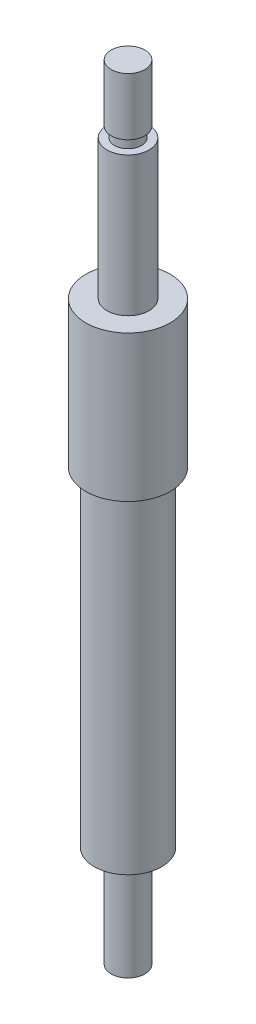
from build123d import *


with BuildPart() as part:
    # Sketch1 → Revolve1 (revolve)
    with BuildSketch(Plane.XY):
        Polygon((0, 0), (2, 0), (2, 12), (4, 12), (4, 51), (5, 51), (5, 68.3), (2.5, 68.3), (2.5, 84.8), (1.6, 84.8), (1.6, 86), (2, 86), (2, 92.8), (0, 92.8), align=None)
    revolve(axis=Axis((0, 0, 0), (0, 1, 0)))


solid = part.part
